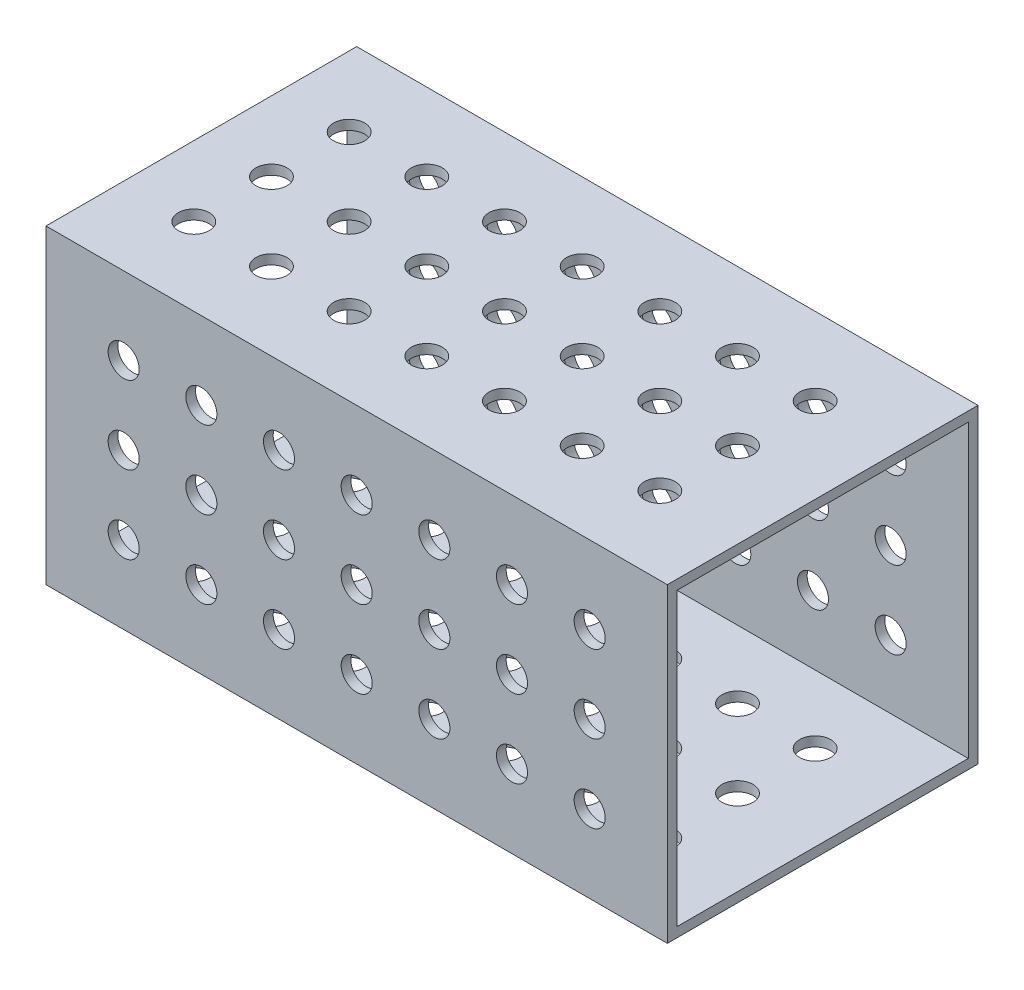
from build123d import *

# Parameters (mm, degrees)
SKETCH1_W           = 50.8
SKETCH1_H           = 50.8
SKETCH1_W_2         = 47.625
SKETCH1_H_2         = 47.625
BOSS_EXTRUDE1_DEPTH = 101.6
SKETCH2_R           = 2.54
CUT_EXTRUDE2_DEPTH  = 609.6
SKETCH3_R           = 2.54
CUT_EXTRUDE3_DEPTH  = 76.2


with BuildPart() as part:
    # Sketch1 → Boss-Extrude1 (new body)
    with BuildSketch(Plane(origin=(0, 0, 0), x_dir=(0, 0, -1), z_dir=(1, 0, 0))):
        Rectangle(SKETCH1_W, SKETCH1_H)
        Rectangle(SKETCH1_W_2, SKETCH1_H_2, mode=Mode.SUBTRACT)
    extrude(amount=BOSS_EXTRUDE1_DEPTH)

    # Sketch2 → Cut-Extrude2 (cut)
    with BuildSketch(Plane.XY.offset(25.4)):
        with Locations((12.7, 12.7)):
            Circle(SKETCH2_R)
        with Locations((12.7, 0)):
            Circle(SKETCH2_R)
        with Locations((12.7, -12.7)):
            Circle(SKETCH2_R)
        with Locations((25.4, 12.7)):
            Circle(SKETCH2_R)
        with Locations((25.4, 0)):
            Circle(SKETCH2_R)
        with Locations((25.4, -12.7)):
            Circle(SKETCH2_R)
        with Locations((38.1, 12.7)):
            Circle(SKETCH2_R)
        with Locations((38.1, 0)):
            Circle(SKETCH2_R)
        with Locations((38.1, -12.7)):
            Circle(SKETCH2_R)
        with Locations((50.8, 12.7)):
            Circle(SKETCH2_R)
        with Locations((50.8, 0)):
            Circle(SKETCH2_R)
        with Locations((50.8, -12.7)):
            Circle(SKETCH2_R)
        with Locations((63.5, 12.7)):
            Circle(SKETCH2_R)
        with Locations((63.5, 0)):
            Circle(SKETCH2_R)
        with Locations((63.5, -12.7)):
            Circle(SKETCH2_R)
        with Locations((76.2, 12.7)):
            Circle(SKETCH2_R)
        with Locations((76.2, 0)):
            Circle(SKETCH2_R)
        with Locations((76.2, -12.7)):
            Circle(SKETCH2_R)
        with Locations((88.9, 12.7)):
            Circle(SKETCH2_R)
        with Locations((88.9, 0)):
            Circle(SKETCH2_R)
        with Locations((88.9, -12.7)):
            Circle(SKETCH2_R)
    extrude(amount=-CUT_EXTRUDE2_DEPTH, mode=Mode.SUBTRACT)

    # Sketch3 → Cut-Extrude3 (cut)
    with BuildSketch(Plane.XZ.offset(25.4)):
        with Locations((11.466852122, 12.7)):
            Circle(SKETCH3_R)
        with Locations((11.466852122, 0)):
            Circle(SKETCH3_R)
        with Locations((11.471230502, -12.699999245)):
            Circle(SKETCH3_R)
        with Locations((24.166852122, 12.699999245)):
            Circle(SKETCH3_R)
        with Locations((24.166852122, -7.55e-07)):
            Circle(SKETCH3_R)
        with Locations((24.171230502, -12.7)):
            Circle(SKETCH3_R)
        with Locations((36.866852122, 12.699999245)):
            Circle(SKETCH3_R)
        with Locations((36.871230502, 0)):
            Circle(SKETCH3_R)
        with Locations((36.871230502, -12.7)):
            Circle(SKETCH3_R)
        with Locations((49.566852122, 12.699999245)):
            Circle(SKETCH3_R)
        with Locations((49.571230502, 0)):
            Circle(SKETCH3_R)
        with Locations((49.571230502, -12.7)):
            Circle(SKETCH3_R)
        with Locations((62.266852122, 12.699999245)):
            Circle(SKETCH3_R)
        with Locations((62.271230502, 0)):
            Circle(SKETCH3_R)
        with Locations((62.271230502, -12.7)):
            Circle(SKETCH3_R)
        with Locations((74.966852122, 12.699999245)):
            Circle(SKETCH3_R)
        with Locations((74.971230502, 0)):
            Circle(SKETCH3_R)
        with Locations((74.971230502, -12.7)):
            Circle(SKETCH3_R)
        with Locations((87.671230502, 12.7)):
            Circle(SKETCH3_R)
        with Locations((87.671230502, 0)):
            Circle(SKETCH3_R)
        with Locations((87.671230502, -12.7)):
            Circle(SKETCH3_R)
    extrude(amount=-CUT_EXTRUDE3_DEPTH, mode=Mode.SUBTRACT)


solid = part.part
